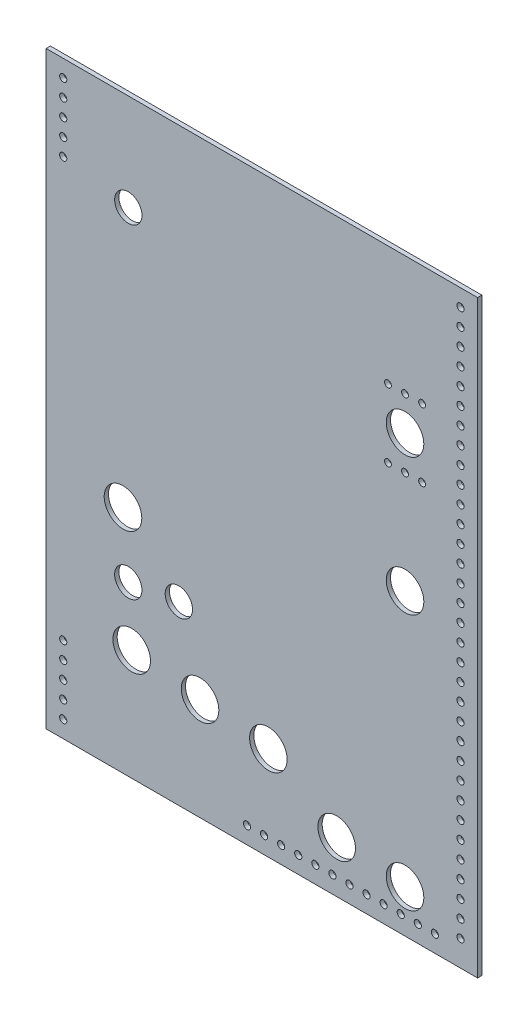
from build123d import *

# Parameters (mm, degrees)
SKETCH1_W           = 320.802
SKETCH1_H           = 438.15
BOSS_EXTRUDE1_DEPTH = 3.175
SKETCH2_R           = 13.97
SKETCH2_R_2         = 2.54
CUT_EXTRUDE1_DEPTH  = 3.175
SKETCH3_R           = 10.16
CUT_EXTRUDE3_DEPTH  = 3.175
SKETCH4_R           = 2.667
CUT_EXTRUDE4_DEPTH  = 3.175
SKETCH5_R           = 13.97
CUT_EXTRUDE5_DEPTH  = 3.175


with BuildPart() as part:
    # Sketch1 → Boss-Extrude1 (new body)
    with BuildSketch(Plane.XY):
        Rectangle(SKETCH1_W, SKETCH1_H)
    extrude(amount=BOSS_EXTRUDE1_DEPTH)

    # Sketch2 → Cut-Extrude1 (cut)
    with BuildSketch(Plane.XY.offset(3.175)):
        with Locations((106.445821197, -187.325)):
            Circle(SKETCH2_R)
        with Locations((55.626, -180.975)):
            Circle(SKETCH2_R)
        with Locations((4.826, -149.225)):
            Circle(SKETCH2_R)
        with Locations((-45.974, -142.875)):
            Circle(SKETCH2_R)
        with Locations((-96.774, -136.525)):
            Circle(SKETCH2_R)
        with Locations((106.445821197, 3.175)):
            Circle(SKETCH2_R)
        with Locations((106.445821197, 104.775)):
            Circle(SKETCH2_R)
        with Locations((93.745821197, 130.175)):
            Circle(SKETCH2_R_2)
        with Locations((106.445821197, 130.175)):
            Circle(SKETCH2_R_2)
        with Locations((119.145821197, 130.175)):
            Circle(SKETCH2_R_2)
        with Locations((93.745821197, 79.375)):
            Circle(SKETCH2_R_2)
        with Locations((106.445821197, 79.375)):
            Circle(SKETCH2_R_2)
        with Locations((119.145821197, 79.375)):
            Circle(SKETCH2_R_2)
    extrude(amount=-CUT_EXTRUDE1_DEPTH, mode=Mode.SUBTRACT)

    # Sketch3 → Cut-Extrude3 (cut)
    with BuildSketch(Plane.XY.offset(3.175)):
        with Locations((-99.314, -94.107)):
            Circle(SKETCH3_R)
        with Locations((-61.722, -87.757)):
            Circle(SKETCH3_R)
        with Locations((-99.314, 147.193)):
            Circle(SKETCH3_R)
    extrude(amount=-CUT_EXTRUDE3_DEPTH, mode=Mode.SUBTRACT)

    # Sketch4 → Cut-Extrude4 (cut)
    with BuildSketch(Plane.XY.offset(3.175)):
        with Locations((-147.701, -206.481352377)):
            Circle(SKETCH4_R)
        with Locations((-147.701, -193.781352377)):
            Circle(SKETCH4_R)
        with Locations((-147.701, -181.081352377)):
            Circle(SKETCH4_R)
        with Locations((-147.701, -168.381352377)):
            Circle(SKETCH4_R)
        with Locations((-147.701, -155.681352377)):
            Circle(SKETCH4_R)
        with Locations((-147.701, 206.481352377)):
            Circle(SKETCH4_R)
        with Locations((-147.701, 193.781352377)):
            Circle(SKETCH4_R)
        with Locations((-147.701, 181.081352377)):
            Circle(SKETCH4_R)
        with Locations((-147.701, 168.381352377)):
            Circle(SKETCH4_R)
        with Locations((-147.701, 155.681352377)):
            Circle(SKETCH4_R)
        with Locations((147.701, 155.681352377)):
            Circle(SKETCH4_R)
        with Locations((147.701, 168.381352377)):
            Circle(SKETCH4_R)
        with Locations((147.701, 181.081352377)):
            Circle(SKETCH4_R)
        with Locations((147.701, 193.781352377)):
            Circle(SKETCH4_R)
        with Locations((147.701, 206.481352377)):
            Circle(SKETCH4_R)
        with Locations((147.701, 142.981352377)):
            Circle(SKETCH4_R)
        with Locations((147.701, 130.281352377)):
            Circle(SKETCH4_R)
        with Locations((147.701, 117.581352377)):
            Circle(SKETCH4_R)
        with Locations((147.701, 104.881352377)):
            Circle(SKETCH4_R)
        with Locations((147.701, 92.181352377)):
            Circle(SKETCH4_R)
        with Locations((147.701, 79.481352377)):
            Circle(SKETCH4_R)
        with Locations((147.701, 66.781352377)):
            Circle(SKETCH4_R)
        with Locations((147.701, 54.081352377)):
            Circle(SKETCH4_R)
        with Locations((147.701, 41.381352377)):
            Circle(SKETCH4_R)
        with Locations((147.701, 28.681352377)):
            Circle(SKETCH4_R)
        with Locations((147.701, 15.981352377)):
            Circle(SKETCH4_R)
        with Locations((147.701, 3.281352377)):
            Circle(SKETCH4_R)
        with Locations((147.701, -9.418647623)):
            Circle(SKETCH4_R)
        with Locations((147.701, -22.118647623)):
            Circle(SKETCH4_R)
        with Locations((147.701, -34.818647623)):
            Circle(SKETCH4_R)
        with Locations((147.701, -47.518647623)):
            Circle(SKETCH4_R)
        with Locations((147.701, -60.218647623)):
            Circle(SKETCH4_R)
        with Locations((147.701, -72.918647623)):
            Circle(SKETCH4_R)
        with Locations((147.701, -85.618647623)):
            Circle(SKETCH4_R)
        with Locations((147.701, -98.318647623)):
            Circle(SKETCH4_R)
        with Locations((147.701, -111.018647623)):
            Circle(SKETCH4_R)
        with Locations((147.701, -123.718647623)):
            Circle(SKETCH4_R)
        with Locations((147.701, -136.418647623)):
            Circle(SKETCH4_R)
        with Locations((147.701, -149.118647623)):
            Circle(SKETCH4_R)
        with Locations((147.701, -161.818647623)):
            Circle(SKETCH4_R)
        with Locations((147.701, -174.518647623)):
            Circle(SKETCH4_R)
        with Locations((147.701, -187.218647623)):
            Circle(SKETCH4_R)
        with Locations((147.701, -199.918647623)):
            Circle(SKETCH4_R)
        with Locations((103.251, -206.481352377)):
            Circle(SKETCH4_R)
        with Locations((115.951, -206.481352377)):
            Circle(SKETCH4_R)
        with Locations((128.651, -206.481352377)):
            Circle(SKETCH4_R)
        with Locations((90.551, -206.481352377)):
            Circle(SKETCH4_R)
        with Locations((65.151, -206.481352377)):
            Circle(SKETCH4_R)
        with Locations((77.851, -206.481352377)):
            Circle(SKETCH4_R)
        with Locations((52.451, -206.481352377)):
            Circle(SKETCH4_R)
        with Locations((39.751, -206.481352377)):
            Circle(SKETCH4_R)
        with Locations((27.051, -206.481352377)):
            Circle(SKETCH4_R)
        with Locations((14.351, -206.481352377)):
            Circle(SKETCH4_R)
        with Locations((1.651, -206.481352377)):
            Circle(SKETCH4_R)
        with Locations((-11.049, -206.481352377)):
            Circle(SKETCH4_R)
    extrude(amount=-CUT_EXTRUDE4_DEPTH, mode=Mode.SUBTRACT)

    # Sketch5 → Cut-Extrude5 (cut)
    with BuildSketch(Plane.XY.offset(3.175)):
        with Locations((-103.251, -47.836094574)):
            Circle(SKETCH5_R)
    extrude(amount=-CUT_EXTRUDE5_DEPTH, mode=Mode.SUBTRACT)


solid = part.part
